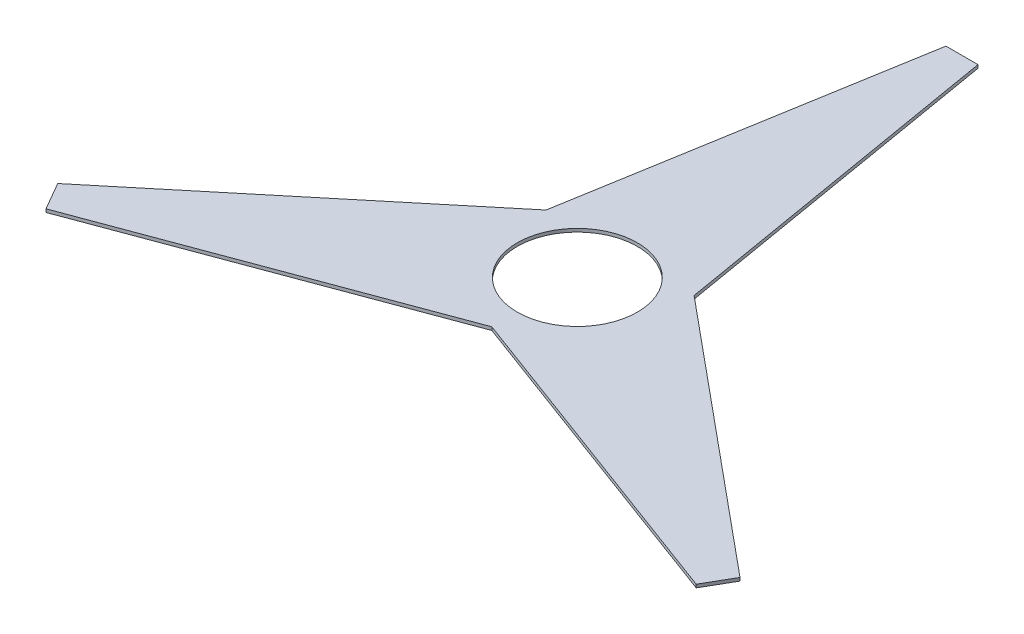
from build123d import *

# Parameters (mm, degrees)
SALIENTE_EXTRUIR2_DEPTH = 10
CROQUIS2_R              = 187.5
CORTAR_EXTRUIR1_DEPTH   = 10


with BuildPart() as part:
    # Croquis1 → Saliente-Extruir2 (new body)
    with BuildSketch(Plane(origin=(0, 0, 0), x_dir=(1, 0, 0), z_dir=(0, 1, 0))):
        Polygon((1064.230484541, -556.698729811), (230.951615741, 133.339977518), (50, 1200), (-50, 1200), (-230.951615741, 133.339977518), (-1064.230484541, -556.698729811), (-1014.230484541, -643.301270189), (0, -266.679955035), (1014.230484541, -643.301270189), align=None)
    extrude(amount=SALIENTE_EXTRUIR2_DEPTH)

    # Croquis2 → Cortar-Extruir1 (cut)
    with BuildSketch(Plane(origin=(0, 10, 0), x_dir=(1, 0, 0), z_dir=(0, 1, 0))):
        Circle(CROQUIS2_R)
    extrude(amount=-CORTAR_EXTRUIR1_DEPTH, mode=Mode.SUBTRACT)


solid = part.part
